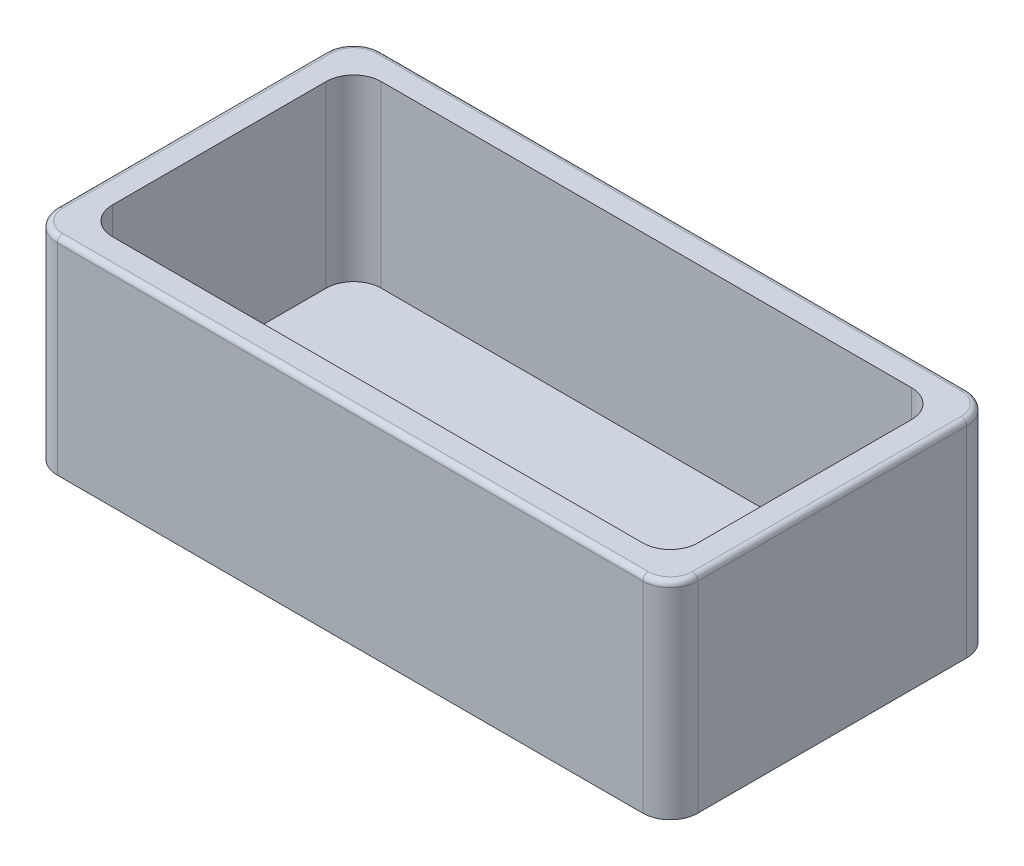
from build123d import *

# Parameters (mm, degrees)
BOSS_EXTRUDE1_DEPTH = 75
SHELL13_T           = -10
FILLET5_R           = 10
FILLET8_R           = 2
FILLET9_R           = 10


with BuildPart() as part:
    # Sketch1 → Boss-Extrude1 (new body)
    with BuildSketch(Plane(origin=(0, 0, 0), x_dir=(1, 0, 0), z_dir=(0, 1, 0))):
        Polygon((-116.60063424078889, 55.81031027640047), (116.00742939980823, 55.81031027640047), (116.00742939980825, -61.81321623229694), (-116.60063424078888, -61.81321623229694), align=None)
    extrude(amount=BOSS_EXTRUDE1_DEPTH)

    # Shell13
    shell13_openings = [part.faces().sort_by_distance(p)[0] for p in [
        (-0.29660242, 75, 3.001452978),
    ]]
    offset(amount=SHELL13_T, openings=shell13_openings, kind=Kind.INTERSECTION)

    # Fillet5
    fillet5_edges = [part.edges().sort_by_distance(p)[0] for p in [
        (-106.60063424078889, 42.5, -45.81031027640047),
        (-106.60063424078889, 42.5, 51.81321623229694),
        (106.00742939980825, 42.5, 51.81321623229694),
        (106.00742939980823, 42.5, -45.81031027640047),
    ]]
    fillet(fillet5_edges, radius=FILLET5_R)

    # Fillet8
    fillet8_edges = [part.edges().sort_by_distance(p)[0] for p in [
        (116.00742939980825, 75, 3.001452977948233),
        (-0.2966024204903306, 75, -55.81031027640047),
        (-116.60063424078888, 75, 3.001452977948233),
        (-0.2966024204903164, 75, 61.81321623229694),
    ]]
    fillet(fillet8_edges, radius=FILLET8_R)

    # Fillet9
    # the kernel refuses this fillet: 10 mm, written as the material it takes off along each edge
    with BuildSketch(Plane(origin=(106.00742939980825, 75, 51.81321623229694), x_dir=(0, 0, 1), z_dir=(-1, 0, 0))) as fillet9_piece_1:
        with BuildLine():
            CenterArc((8, -2), 2, 0, 90)
            Line((10, -2), (10, 0))
            Line((10, 0), (8, 0))
        make_face()
    revolve(axis=Axis((106.00742939980825, 75, 51.81321623229694), (0, 1, 0)), revolution_arc=90.00000000000001, mode=Mode.SUBTRACT)
    with BuildSketch(Plane(origin=(-106.60063424078888, 75, 51.81321623229694), x_dir=(-1, 0, 1.2e-16), z_dir=(-1.2e-16, 0, -1))) as fillet9_piece_2:
        with BuildLine():
            CenterArc((8, -2), 2, 0, 90)
            Line((10, -2), (10, 0))
            Line((10, 0), (8, 0))
        make_face()
    revolve(axis=Axis((-106.60063424078888, 75, 51.81321623229694), (0, 1, 0)), revolution_arc=90, mode=Mode.SUBTRACT)
    with BuildSketch(Plane(origin=(106.00742939980823, 75, -45.81031027640047), x_dir=(1, 0, -1.2e-16), z_dir=(1.2e-16, 0, 1))) as fillet9_piece_3:
        with BuildLine():
            CenterArc((8, -2), 2, 0, 90)
            Line((10, -2), (10, 0))
            Line((10, 0), (8, 0))
        make_face()
    revolve(axis=Axis((106.00742939980823, 75, -45.81031027640047), (0, 1, 0)), revolution_arc=90, mode=Mode.SUBTRACT)
    with BuildSketch(Plane(origin=(-106.60063424078889, 75, -45.81031027640047), x_dir=(0, 0, -1), z_dir=(1, 0, 0))) as fillet9_piece_4:
        with BuildLine():
            CenterArc((8, -2), 2, 0, 90)
            Line((10, -2), (10, 0))
            Line((10, 0), (8, 0))
        make_face()
    revolve(axis=Axis((-106.60063424078889, 75, -45.81031027640047), (0, 1, 0)), revolution_arc=90.00000000000001, mode=Mode.SUBTRACT)
    with BuildSketch(Plane(origin=(-116.60063424078889, -25, -55.81031027640047), x_dir=(1, 0, 0), z_dir=(0, 1, 0)), Plane(origin=(116.00742939980823, -25, -55.81031027640047), x_dir=(0, 0, 1), z_dir=(0, 1, 0))) as fillet9_piece_5:
        with BuildLine():
            CenterArc((FILLET9_R, -FILLET9_R), FILLET9_R, 90, 90)
            Line((0, -FILLET9_R), (0, 0))
            Line((0, 0), (FILLET9_R, 0))
        make_face()
    extrude(amount=100.00000000000001, mode=Mode.SUBTRACT)
    with BuildSketch(Plane(origin=(-116.60063424078888, -25, 61.81321623229694), x_dir=(1, 0, 0), z_dir=(0, 1, 0)), Plane(origin=(116.00742939980825, -25, 61.81321623229694), x_dir=(0, 0, -1), z_dir=(0, 1, 0))) as fillet9_piece_6:
        with BuildLine():
            CenterArc((FILLET9_R, FILLET9_R), FILLET9_R, 180, 90)
            Line((0, FILLET9_R), (0, 0))
            Line((0, 0), (FILLET9_R, 0))
        make_face()
    extrude(amount=100.00000000000001, mode=Mode.SUBTRACT)


solid = part.part
